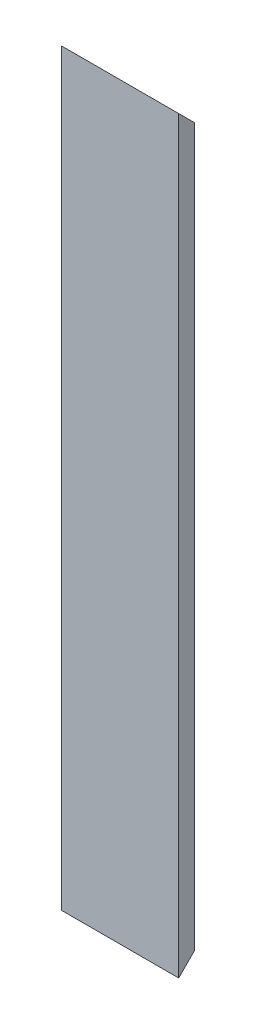
from build123d import *

# Parameters (mm, degrees)
SKETCH1_W           = 15
SKETCH1_H           = 2
BOSS_EXTRUDE1_DEPTH = 96
CHAMFER1_SIZE       = 2


with BuildPart() as part:
    # Sketch1 → Boss-Extrude1 (new body)
    with BuildSketch(Plane(origin=(0, 0, 0), x_dir=(1, 0, 0), z_dir=(0, 1, 0))):
        Rectangle(SKETCH1_W, SKETCH1_H)
    extrude(amount=BOSS_EXTRUDE1_DEPTH)

    # Chamfer1
    chamfer1_edges = [part.edges().sort_by_distance(p)[0] for p in [
        (0, 0, -1),
        (0, 96, -1),
    ]]
    chamfer(chamfer1_edges, length=CHAMFER1_SIZE - 0.0001)  # a hair under: the kernel refuses the full size


solid = part.part
